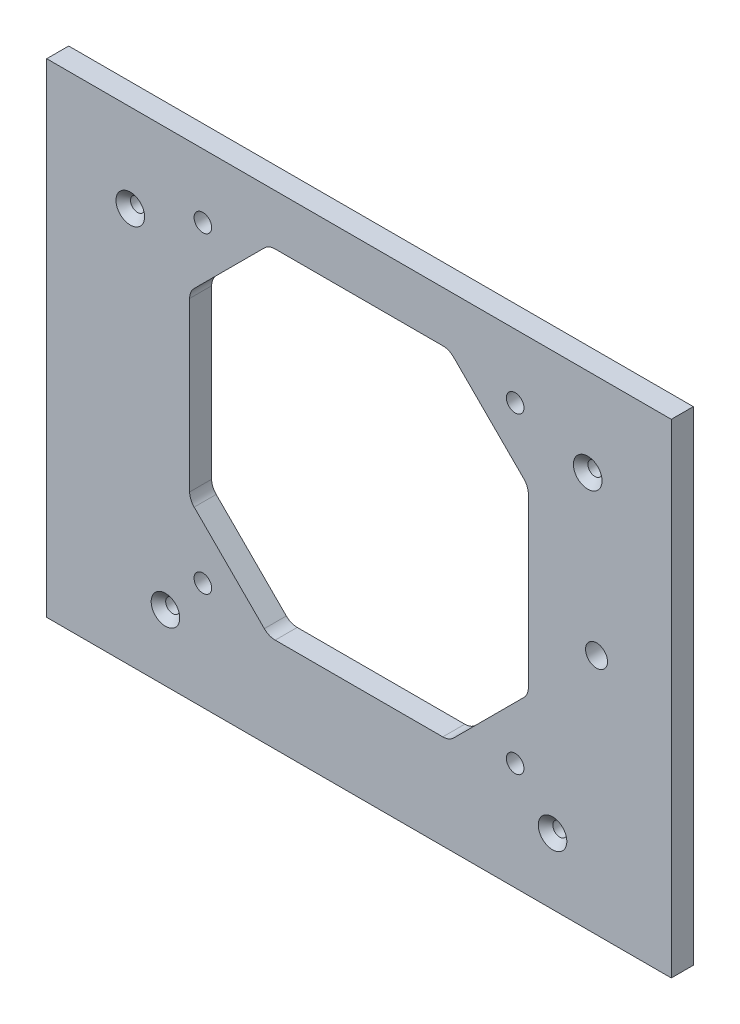
from build123d import *

# Parameters (mm, degrees)
SKETCH1_W                            = 142
SKETCH1_H                            = 110
BOSS_EXTRUDE1_DEPTH                  = 2.5
SKETCH7_R                            = 2
FAN_DEPTH                            = 90.949986103
SKETCH8_R                            = 2.5
FORLED_DEPTH                         = 90.949986103
FILLET1_R                            = 3.5
F_3_2_3_2_DIAMETER_HOLE1_D           = 3.2
F_3_2_3_2_DIAMETER_HOLE1_CSINK_D     = 6.5
F_3_2_3_2_DIAMETER_HOLE1_CSINK_ANGLE = 90
F_3_2_3_2_DIAMETER_HOLE2_D           = 3.2
F_3_2_3_2_DIAMETER_HOLE2_CSINK_D     = 6.5
F_3_2_3_2_DIAMETER_HOLE2_CSINK_ANGLE = 90


with BuildPart() as part:
    # Sketch1 → Boss-Extrude1 (new, symmetric)
    with BuildSketch(Plane.XY):
        Rectangle(SKETCH1_W, SKETCH1_H)
    extrude(amount=BOSS_EXTRUDE1_DEPTH, both=True)

    # Sketch7 → Fan (cut, through all)
    with BuildSketch(Plane.XY.offset(2.5)):
        with Locations((-35.5, -30.5)):
            Circle(SKETCH7_R)
        with Locations((35.5, -30.5)):
            Circle(SKETCH7_R)
        with Locations((35.5, 40.5)):
            Circle(SKETCH7_R)
        with Locations((-35.5, 40.5)):
            Circle(SKETCH7_R)
        Polygon((-20.5, 43.5), (-38.5, 25.5), (-38.5, -15.5), (-20.5, -33.5), (20.5, -33.5), (38.5, -15.5), (38.5, 25.5), (20.5, 43.5), align=None)
    extrude(amount=-FAN_DEPTH, mode=Mode.SUBTRACT)

    # Sketch8 → ForLED (cut, through all)
    with BuildSketch(Plane.XY.offset(2.5)):
        with Locations((54, 0)):
            Circle(SKETCH8_R)
    extrude(amount=-FORLED_DEPTH, mode=Mode.SUBTRACT)

    # Fillet1
    fillet1_edges = [part.edges().sort_by_distance(p)[0] for p in [
        (38.5, 25.5, 0),
        (38.5, -15.5, 0),
        (20.5, -33.5, 0),
        (-38.5, -15.5, 0),
        (-38.5, 25.5, 0),
        (-20.5, 43.5, 0),
        (20.5, 43.5, 0),
        (-20.5, -33.5, 0),
    ]]
    fillet(fillet1_edges, radius=FILLET1_R)

    # Ø3.2 (3.2) Diameter Hole1 (through all)
    with Locations(Plane.XY.offset(2.5)):
        with Locations((-52, 35), (52, 35)):
            CounterSinkHole(F_3_2_3_2_DIAMETER_HOLE1_D / 2, F_3_2_3_2_DIAMETER_HOLE1_CSINK_D / 2, counter_sink_angle=F_3_2_3_2_DIAMETER_HOLE1_CSINK_ANGLE)

    # Ø3.2 (3.2) Diameter Hole2 (through all)
    with Locations(Plane.XY.offset(2.5)):
        with Locations((-44, -40), (44, -40)):
            CounterSinkHole(F_3_2_3_2_DIAMETER_HOLE2_D / 2, F_3_2_3_2_DIAMETER_HOLE2_CSINK_D / 2, counter_sink_angle=F_3_2_3_2_DIAMETER_HOLE2_CSINK_ANGLE)


solid = part.part
